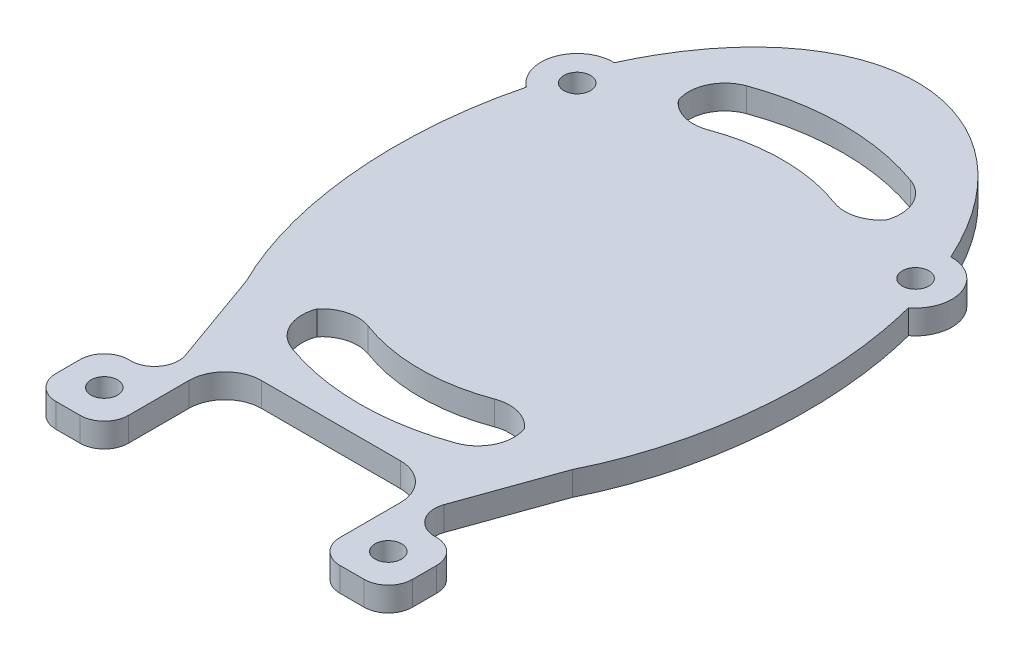
from build123d import *

# Parameters (mm, degrees)
SKETCH1_R           = 1.1
BOSS_EXTRUDE1_DEPTH = 2
SKETCH2_R           = 3
BOSS_EXTRUDE2_DEPTH = 2
CUT_EXTRUDE1_REACH  = 38.623
FILLET2_DEPTH       = 2
CUT_EXTRUDE2_REACH  = 38.623
SKETCH4_W           = 17.5
SKETCH4_H           = 4
FILLET3_R           = 3
FILLET7_R           = 2
CUT_EXTRUDE3_REACH  = 38.623
SKETCH5_R           = 1.1


with BuildPart() as part:
    # Sketch1 → Boss-Extrude1 (new body)
    with BuildSketch(Plane(origin=(0, 0, 0), x_dir=(1, 0, 0), z_dir=(0, 1, 0))):
        with BuildLine():
            Line((-14.75, -32.376764116), (-8.75, -32.376764116))
            Line((-8.75, -32.376764116), (-8.75, -26.376764116))
            Line((-8.75, -26.376764116), (8.75, -26.376764116))
            Line((8.75, -26.376764116), (8.75, -32.376764116))
            Line((8.75, -32.376764116), (14.75, -32.376764116))
            Line((14.75, -32.376764116), (14.75, -26.376764116))
            Line((14.75, -26.376764116), (9.75, -26.376764116))
            Line((9.75, -26.376764116), (13.5, -15.876764116))
            add(Edge.make_bspline(
                [(13.5, -15.876764116), (34.418060424, 26.123235884), (0, 26.123235884), (-34.418060424, 26.123235884), (-13.5, -15.876764116)],
                knots=[0.917554398, 0.917554398, 0.917554398, 3.141592654, 3.141592654, 5.36563091, 5.36563091, 5.36563091], degree=2, weights=[1, 0.442852081, 1, 0.442852081, 1]))
            Line((-13.5, -15.876764116), (-9.75, -26.376764116))
            Line((-9.75, -26.376764116), (-14.75, -26.376764116))
            Line((-14.75, -26.376764116), (-14.75, -32.376764116))
        make_face()
        with Locations(Location((-11.75, -29.376764116, 0), (0, 0, 270))):
            Circle(SKETCH1_R, mode=Mode.SUBTRACT)
        with Locations(Location((11.75, -29.376764116, 0), (0, 0, 270))):
            Circle(SKETCH1_R, mode=Mode.SUBTRACT)
    extrude(amount=BOSS_EXTRUDE1_DEPTH)

    # Sketch2 → Boss-Extrude2 (add)
    with BuildSketch(Plane(origin=(0, 2, 0), x_dir=(1, 0, 0), z_dir=(0, 1, 0))):
        with Locations((-14, 12)):
            Circle(SKETCH2_R)
        with Locations((14, 12)):
            Circle(SKETCH2_R)
    extrude(amount=-BOSS_EXTRUDE2_DEPTH)

    # Sketch3 → Cut-Extrude1 (cut, up to next)
    with BuildSketch(Plane(origin=(0, 2, 0), x_dir=(1, 0, 0), z_dir=(0, 1, 0)), mode=Mode.PRIVATE) as cut_extrude1_sk1:
        with BuildLine():
            Line((10, 17.320508076), (7.5, 12.990381057))
            ThreePointArc((7.5, 12.990381057), (0, 15), (-7.5, 12.990381057))
            Line((-7.5, 12.990381057), (-10, 17.320508076))
            ThreePointArc((-10, 17.320508076), (0, 20), (10, 17.320508076))
        make_face()
    cut_extrude1_tool1 = extrude(cut_extrude1_sk1.sketch, amount=-CUT_EXTRUDE1_REACH, mode=Mode.PRIVATE) & part.part
    # Sketch3 → Cut-Extrude1 (cut, up to next)
    with BuildSketch(Plane(origin=(0, 2, 0), x_dir=(1, 0, 0), z_dir=(0, 1, 0)), mode=Mode.PRIVATE) as cut_extrude1_sk2:
        with BuildLine():
            Line((-7.5, -12.990381057), (-10, -17.320508076))
            ThreePointArc((-10, -17.320508076), (0, -20), (10, -17.320508076))
            Line((10, -17.320508076), (7.5, -12.990381057))
            ThreePointArc((7.5, -12.990381057), (0, -15), (-7.5, -12.990381057))
        make_face()
    cut_extrude1_tool2 = extrude(cut_extrude1_sk2.sketch, amount=-CUT_EXTRUDE1_REACH, mode=Mode.PRIVATE) & part.part
    add(cut_extrude1_tool1.solids().sort_by_distance((0, 2, -16.824951))[0], mode=Mode.SUBTRACT)
    add(cut_extrude1_tool2.solids().sort_by_distance((0, 2, 16.824951))[0], mode=Mode.SUBTRACT)

    # Fillet2: read off the stored shape, not the designer's step
    # Fillet2 outline → Fillet2 (add)
    with BuildSketch(Plane(origin=(0, 0, 0), x_dir=(1, 0, 0), z_dir=(0, 1, 0))):
        with BuildLine():
            ThreePointArc((8.582912204, -14.952521925), (8.488508665, -17.256953182), (6.786498887, -18.813384407))
            ThreePointArc((6.786498887, -18.813384407), (8.426375624, -18.138252227), (10, -17.320508076))
            Line((10, -17.320508076), (7.5, -12.990381057))
            ThreePointArc((7.5, -12.990381057), (6.387391933, -13.572075165), (5.230036219, -14.058688458))
            ThreePointArc((5.230036219, -14.058688458), (7.048816066, -13.971663912), (8.582912204, -14.952521925))
        make_face()
        with BuildLine():
            ThreePointArc((-10, -17.320508076), (-8.426375624, -18.138252227), (-6.786498887, -18.813384407))
            ThreePointArc((-6.786498887, -18.813384407), (-8.488508665, -17.256953182), (-8.582912204, -14.952521925))
            ThreePointArc((-8.582912204, -14.952521925), (-7.048816066, -13.971663912), (-5.230036219, -14.058688457))
            ThreePointArc((-5.230036219, -14.058688457), (-6.387391933, -13.572075165), (-7.5, -12.990381057))
            Line((-7.5, -12.990381057), (-10, -17.320508076))
        make_face()
        with BuildLine():
            ThreePointArc((8.582912204, 14.952521925), (7.048816066, 13.971663912), (5.230036219, 14.058688457))
            ThreePointArc((5.230036219, 14.058688457), (6.387391933, 13.572075165), (7.5, 12.990381057))
            Line((7.5, 12.990381057), (10, 17.320508076))
            ThreePointArc((10, 17.320508076), (8.426375624, 18.138252227), (6.786498887, 18.813384407))
            ThreePointArc((6.786498887, 18.813384407), (8.488508665, 17.256953182), (8.582912204, 14.952521925))
        make_face()
        with BuildLine():
            ThreePointArc((-7.5, 12.990381057), (-6.387391933, 13.572075165), (-5.230036219, 14.058688458))
            ThreePointArc((-5.230036219, 14.058688458), (-7.048816066, 13.971663912), (-8.582912204, 14.952521925))
            ThreePointArc((-8.582912204, 14.952521925), (-8.488508665, 17.256953182), (-6.786498887, 18.813384407))
            ThreePointArc((-6.786498887, 18.813384407), (-8.426375624, 18.138252227), (-10, 17.320508076))
            Line((-10, 17.320508076), (-7.5, 12.990381057))
        make_face()
    extrude(amount=FILLET2_DEPTH)

    # Sketch4 → Cut-Extrude2 (cut, up to next)
    with BuildSketch(Plane(origin=(0, 2, 0), x_dir=(1, 0, 0), z_dir=(0, 1, 0)), mode=Mode.PRIVATE) as cut_extrude2_sk1:
        with Locations((0, -24.376764116)):
            Rectangle(SKETCH4_W, SKETCH4_H)
    cut_extrude2_tool1 = extrude(cut_extrude2_sk1.sketch, amount=-CUT_EXTRUDE2_REACH, mode=Mode.PRIVATE) & part.part
    add(cut_extrude2_tool1.solids().sort_by_distance((0, 2, 24.376764))[0], mode=Mode.SUBTRACT)

    # Fillet3
    fillet3_edges = [part.edges().sort_by_distance(p)[0] for p in [
        (-8.75, 1, 22.376764116),
        (8.75, 1, 22.376764116),
    ]]
    fillet(fillet3_edges, radius=FILLET3_R)

    # Fillet7
    fillet7_edges = [part.edges().sort_by_distance(p)[0] for p in [
        (9.75, 1, 26.376764116),
        (14.75, 1, 26.376764116),
        (14.75, 1, 32.376764116),
        (8.75, 1, 32.376764116),
        (-8.75, 1, 32.376764116),
        (-14.75, 1, 32.376764116),
        (-14.75, 1, 26.376764116),
        (-9.75, 1, 26.376764116),
    ]]
    fillet(fillet7_edges, radius=FILLET7_R)

    # Sketch5 → Cut-Extrude3 (cut, up to next)
    with BuildSketch(Plane(origin=(0, 2, 0), x_dir=(1, 0, 0), z_dir=(0, 1, 0)), mode=Mode.PRIVATE) as cut_extrude3_sk1:
        with Locations(Location((-14, 12, 0), (0, 0, 270))):
            Circle(SKETCH5_R)
    cut_extrude3_tool1 = extrude(cut_extrude3_sk1.sketch, amount=-CUT_EXTRUDE3_REACH, mode=Mode.PRIVATE) & part.part
    # Sketch5 → Cut-Extrude3 (cut, up to next)
    with BuildSketch(Plane(origin=(0, 2, 0), x_dir=(1, 0, 0), z_dir=(0, 1, 0)), mode=Mode.PRIVATE) as cut_extrude3_sk2:
        with Locations(Location((14, 12, 0), (0, 0, 90))):
            Circle(SKETCH5_R)
    cut_extrude3_tool2 = extrude(cut_extrude3_sk2.sketch, amount=-CUT_EXTRUDE3_REACH, mode=Mode.PRIVATE) & part.part
    add(cut_extrude3_tool1.solids().sort_by_distance((-14, 2, -12))[0], mode=Mode.SUBTRACT)
    add(cut_extrude3_tool2.solids().sort_by_distance((14, 2, -12))[0], mode=Mode.SUBTRACT)


solid = part.part
